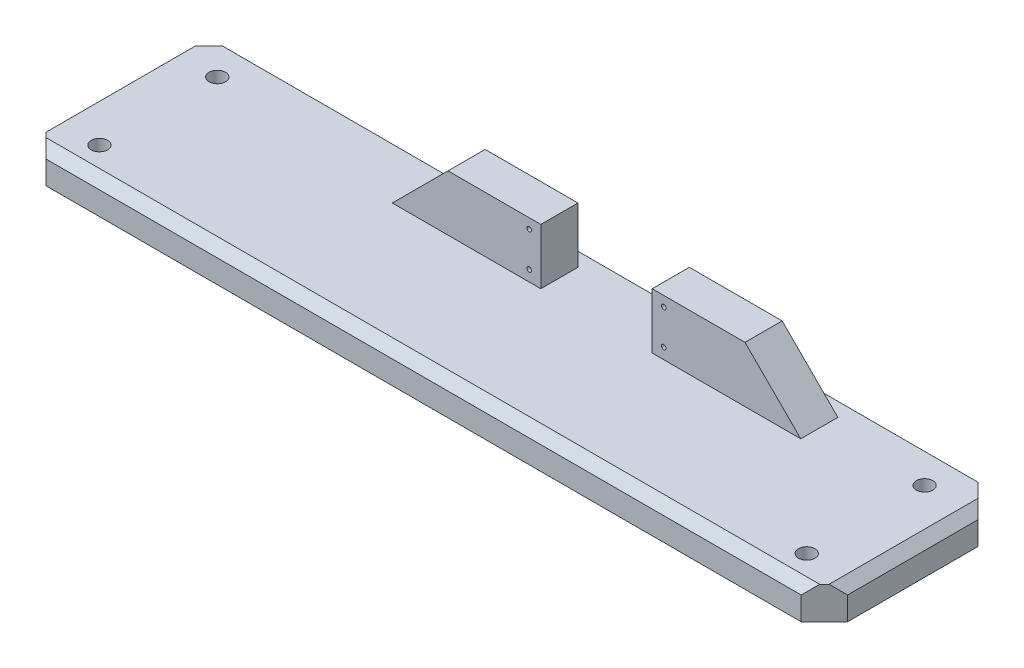
from build123d import *

# Parameters (mm, degrees)
SKETCH1_W           = 172.72
SKETCH1_H           = 38.1
BOSS_EXTRUDE1_DEPTH = 7
SKETCH2_R           = 1.778
CUT_EXTRUDE1_DEPTH  = 17
SKETCH3_W           = 20
SKETCH3_H           = 8
BOSS_EXTRUDE2_DEPTH = 12
SKETCH4_R           = 0.5
CUT_EXTRUDE2_DEPTH  = 10
CHAMFER1_SIZE       = 12
CHAMFER2_SIZE       = 2
CHAMFER3_SIZE       = 5


# Some blends are built 0.0001 mm under size
with BuildPart() as part:
    # Sketch1 → Boss-Extrude1 (new body)
    with BuildSketch(Plane(origin=(0, 0, 0), x_dir=(1, 0, 0), z_dir=(0, 1, 0))):
        with Locations((7.116134283, -6.04768057)):
            Rectangle(SKETCH1_W, SKETCH1_H)
    extrude(amount=BOSS_EXTRUDE1_DEPTH)

    # Sketch2 → Cut-Extrude1 (cut)
    with BuildSketch(Plane(origin=(0, 7, 0), x_dir=(1, 0, 0), z_dir=(0, 1, 0))):
        with Locations(Location((-69.083865717, 6.65231943, 0), (0, 0, 270))):
            Circle(SKETCH2_R)
        with Locations(Location((-69.083865717, -18.74768057, 0), (0, 0, 270))):
            Circle(SKETCH2_R)
        with Locations(Location((83.316134283, 6.65231943, 0), (0, 0, 270))):
            Circle(SKETCH2_R)
        with Locations(Location((83.316134283, -18.74768057, 0), (0, 0, 270))):
            Circle(SKETCH2_R)
    extrude(amount=-CUT_EXTRUDE1_DEPTH, mode=Mode.SUBTRACT)

    # Sketch3 → Boss-Extrude2 (add)
    with BuildSketch(Plane(origin=(0, 7, 0), x_dir=(1, 0, 0), z_dir=(0, 1, 0))):
        with Locations((-4.723865717, 6.00231943)):
            Rectangle(SKETCH3_W, SKETCH3_H)
        with Locations((39.276134283, 6.00231943)):
            Rectangle(SKETCH3_W, SKETCH3_H)
    extrude(amount=BOSS_EXTRUDE2_DEPTH)

    # Sketch4 → Cut-Extrude2 (cut)
    with BuildSketch(Plane(origin=(0, 0, -10.00231943), x_dir=(-1, 0, 0), z_dir=(0, 0, -1))):
        with Locations((-31.776134283, 16.85)):
            Circle(SKETCH4_R)
        with Locations((-31.776134283, 9.35)):
            Circle(SKETCH4_R)
        with Locations((-2.776134283, 9.35)):
            Circle(SKETCH4_R)
        with Locations((-2.776134283, 16.85)):
            Circle(SKETCH4_R)
    extrude(amount=-CUT_EXTRUDE2_DEPTH, mode=Mode.SUBTRACT)

    # Chamfer1
    chamfer1_edges = [part.edges().sort_by_distance(p)[0] for p in [
        (49.276134283, 7, -6.00231943),
        (-14.723865717, 7, -6.00231943),
    ]]
    chamfer(chamfer1_edges, length=CHAMFER1_SIZE - 0.0001)  # a hair under: the kernel refuses the full size

    # Chamfer2
    chamfer2_edges = [part.edges().sort_by_distance(p)[0] for p in [
        (93.476134283, 7, 6.04768057),
        (-79.243865717, 7, 6.04768057),
        (7.116134283, 7, 25.09768057),
    ]]
    chamfer(chamfer2_edges, length=CHAMFER2_SIZE)

    # Chamfer3
    # the kernel refuses this chamfer: 5 mm, written as the material it takes off along each edge
    with BuildSketch(Plane(origin=(93.476134283, -12.85841494, -13.00231943), x_dir=(-0.9996219169112968, 0, -0.027495876610586282), z_dir=(0, 1, 0)), Plane(origin=(93.476134283, -12.85841494, 25.09768057), x_dir=(0.0274958766105877, 0, -0.9996219169112968), z_dir=(0, 1, 0))) as chamfer3_piece_1:
        Polygon((CHAMFER3_SIZE * 0.999621916911, CHAMFER3_SIZE * 0.0274958766106), (-CHAMFER3_SIZE * 0.0274958766106, CHAMFER3_SIZE * 0.999621916911), (0, 0), align=None)
    extrude(amount=30.71682988, mode=Mode.SUBTRACT)
    with BuildSketch(Plane(origin=(-79.243865717, -12.85841494, 25.09768057), x_dir=(-0.0274958766105877, 0, -0.9996219169112968), z_dir=(0, 1, 0)), Plane(origin=(-79.243865717, -12.85841494, -13.00231943), x_dir=(0.9996219169112968, 0, -0.027495876610586282), z_dir=(0, 1, 0))) as chamfer3_piece_2:
        Polygon((CHAMFER3_SIZE * 0.999621916911, -CHAMFER3_SIZE * 0.0274958766106), (-CHAMFER3_SIZE * 0.0274958766106, -CHAMFER3_SIZE * 0.999621916911), (0, 0), align=None)
    extrude(amount=30.71682988, mode=Mode.SUBTRACT)


solid = part.part
